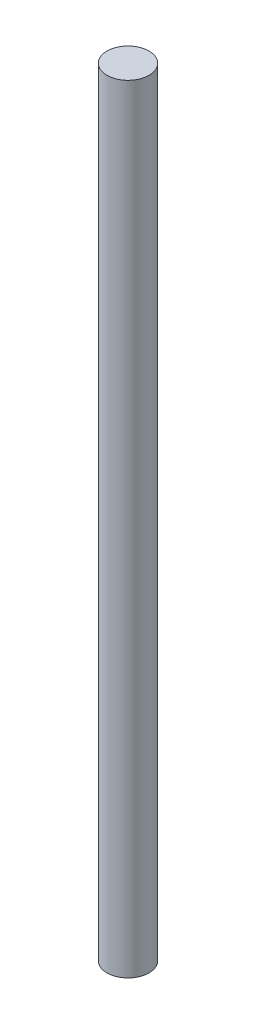
from build123d import *

# Parameters (mm, degrees)
SKETCH1_R           = 12.5
BOSS_EXTRUDE1_DEPTH = 462.002000048


with BuildPart() as part:
    # Sketch1 → Boss-Extrude1 (new body)
    with BuildSketch(Plane(origin=(0, 0, 0), x_dir=(1, 0, 0), z_dir=(0, 1, 0))):
        Circle(SKETCH1_R)
    extrude(amount=BOSS_EXTRUDE1_DEPTH)


solid = part.part
